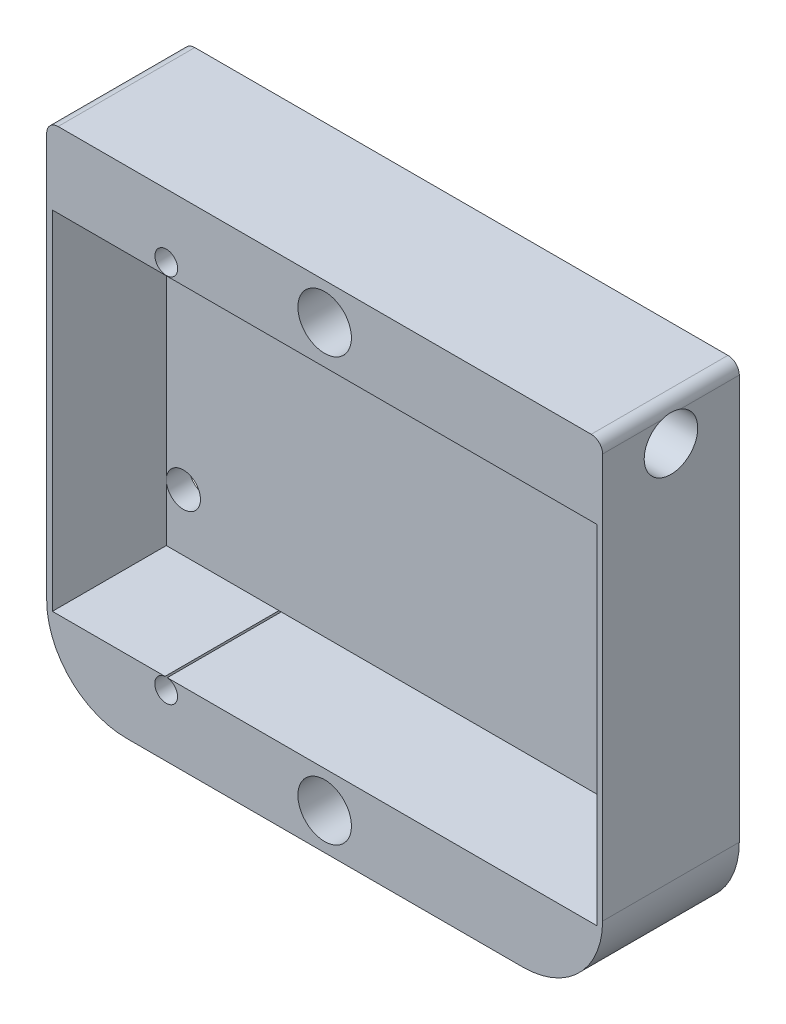
from build123d import *

# Parameters (mm, degrees)
SKIZZE4_W                       = 47.8
SKIZZE4_H                       = 37.511655438
AUFSATZ_LINEAR_AUSTRAGEN2_DEPTH = 2
SKIZZE5_W                       = 47.8
SKIZZE5_H                       = 3.6
SKIZZE5_H_2                     = 3.4
AUFSATZ_LINEAR_AUSTRAGEN3_DEPTH = 12
SKIZZE6_R                       = 1
SCHNITT_LINEAR_AUSTRAGEN1_DEPTH = 19
SKIZZE8_W                       = 47.8
SKIZZE8_H                       = 12
AUFSATZ_LINEAR_AUSTRAGEN4_DEPTH = 3
SKIZZE9_W                       = 47.8
SKIZZE9_H                       = 12
AUFSATZ_LINEAR_AUSTRAGEN5_DEPTH = 3
SKIZZE10_W                      = 12
SKIZZE10_H                      = 43.511655438
AUFSATZ_LINEAR_AUSTRAGEN6_DEPTH = 0.5
SKIZZE11_W                      = 12
SKIZZE11_H                      = 43.511655438
AUFSATZ_LINEAR_AUSTRAGEN7_DEPTH = 0.5
SKIZZE12_R                      = 1.5
SCHNITT_LINEAR_AUSTRAGEN2_DEPTH = 9
SCHNITT_LINEAR_START            = -9
SKIZZE13_R                      = 1.5
SCHNITT_LINEAR_AUSTRAGEN3_DEPTH = 9
SKIZZE14_R                      = 2.35
SCHNITT_LINEAR_AUSTRAGEN4_DEPTH = 4
SCHNITT_LINEAR_START_2          = -4
SKIZZE15_R                      = 2.35
SCHNITT_LINEAR_AUSTRAGEN5_DEPTH = 4
VERRUNDUNG3_R                   = 1
VERRUNDUNG4_R                   = 1
VERRUNDUNG5_R                   = 7
SKIZZE17_R                      = 2.35
SCHNITT_LINEAR_AUSTRAGEN6_DEPTH = 4
SKIZZE18_R                      = 1.5
SCHNITT_LINEAR_AUSTRAGEN7_DEPTH = 14
SKIZZE19_R                      = 1.5
SCHNITT_LINEAR_AUSTRAGEN8_DEPTH = 14


with BuildPart() as part:
    # Skizze4 → Aufsatz-Linear austragen2 (new body)
    with BuildSketch(Plane.XY):
        with Locations((11.372253432, 7.302337754)):
            Rectangle(SKIZZE4_W, SKIZZE4_H)
    extrude(amount=AUFSATZ_LINEAR_AUSTRAGEN2_DEPTH)

    # Skizze5 → Aufsatz-Linear austragen3 (add)
    with BuildSketch(Plane(origin=(0, 0, 0), x_dir=(-1, 0, 0), z_dir=(0, 0, -1))):
        with Locations((-11.372253432, 24.258165473)):
            Rectangle(SKIZZE5_W, SKIZZE5_H)
        with Locations((-11.372253432, -9.753489965)):
            Rectangle(SKIZZE5_W, SKIZZE5_H_2)
    extrude(amount=-AUFSATZ_LINEAR_AUSTRAGEN3_DEPTH)

    # Skizze6 → Schnitt-Linear austragen1 (cut)
    with BuildSketch(Plane(origin=(0, 0, 0), x_dir=(-1, 0, 0), z_dir=(0, 0, -1))):
        with Locations((2.527746568, 23.483879087)):
            Circle(SKIZZE6_R)
        with Locations((2.540359159, -9.04853229)):
            Circle(SKIZZE6_R)
    extrude(amount=-SCHNITT_LINEAR_AUSTRAGEN1_DEPTH, mode=Mode.SUBTRACT)

    # Skizze8 → Aufsatz-Linear austragen4 (add)
    with BuildSketch(Plane(origin=(0, 26.058165473, 0), x_dir=(1, 0, 0), z_dir=(0, 1, 0))):
        with Locations((11.372253432, -6)):
            Rectangle(SKIZZE8_W, SKIZZE8_H)
    extrude(amount=AUFSATZ_LINEAR_AUSTRAGEN4_DEPTH)

    # Skizze9 → Aufsatz-Linear austragen5 (add)
    with BuildSketch(Plane.XZ.offset(11.453489965)):
        with Locations((11.372253432, 6)):
            Rectangle(SKIZZE9_W, SKIZZE9_H)
    extrude(amount=AUFSATZ_LINEAR_AUSTRAGEN5_DEPTH)

    # Skizze10 → Aufsatz-Linear austragen6 (add)
    with BuildSketch(Plane.ZY.offset(12.527746568)):
        with Locations((6, 7.302337754)):
            Rectangle(SKIZZE10_W, SKIZZE10_H)
    extrude(amount=AUFSATZ_LINEAR_AUSTRAGEN6_DEPTH)

    # Skizze11 → Aufsatz-Linear austragen7 (add)
    with BuildSketch(Plane(origin=(35.272253432, 0, 0), x_dir=(0, 0, -1), z_dir=(1, 0, 0))):
        with Locations((-6, 7.302337754)):
            Rectangle(SKIZZE11_W, SKIZZE11_H)
    extrude(amount=AUFSATZ_LINEAR_AUSTRAGEN7_DEPTH)

    # Skizze12 → Schnitt-Linear austragen2 (cut)
    with BuildSketch(Plane.ZY.offset(13.027746568)):
        with Locations(Location((6, 25.858165473, 0), (0, 0, 270))):
            Circle(SKIZZE12_R)
    extrude(amount=-SCHNITT_LINEAR_AUSTRAGEN2_DEPTH, mode=Mode.SUBTRACT)

    # Skizze13 → Schnitt-Linear austragen3 (cut)
    with BuildSketch(Plane(origin=(35.772253432, 0, 0), x_dir=(0, 0, -1), z_dir=(1, 0, 0)).offset(SCHNITT_LINEAR_START)):
        with Locations(Location((-6, 25.858165473, 0), (0, 0, 270))):
            Circle(SKIZZE13_R)
    extrude(amount=SCHNITT_LINEAR_AUSTRAGEN3_DEPTH, mode=Mode.SUBTRACT)

    # Skizze14 → Schnitt-Linear austragen4 (cut)
    with BuildSketch(Plane.ZY.offset(13.027746568)):
        with Locations(Location((6, 25.858165473, 0), (0, 0, 270))):
            Circle(SKIZZE14_R)
    extrude(amount=-SCHNITT_LINEAR_AUSTRAGEN4_DEPTH, mode=Mode.SUBTRACT)

    # Skizze15 → Schnitt-Linear austragen5 (cut)
    with BuildSketch(Plane(origin=(35.772253432, 0, 0), x_dir=(0, 0, -1), z_dir=(1, 0, 0)).offset(SCHNITT_LINEAR_START_2)):
        with Locations(Location((-6, 25.858165473, 0), (0, 0, 270))):
            Circle(SKIZZE15_R)
    extrude(amount=SCHNITT_LINEAR_AUSTRAGEN5_DEPTH, mode=Mode.SUBTRACT)

    # Verrundung3
    # the kernel refuses this fillet: 1 mm, written as the material it takes off along each edge
    with BuildSketch(Plane(origin=(35.772253432, 29.058165473, 14.5), x_dir=(-1, 0, 0), z_dir=(0, 0, -1))) as verrundung3_piece_1:
        with BuildLine():
            CenterArc((VERRUNDUNG3_R, -VERRUNDUNG3_R), VERRUNDUNG3_R, 90, 90)
            Line((0, -VERRUNDUNG3_R), (0, 0))
            Line((0, 0), (VERRUNDUNG3_R, 0))
        make_face()
    extrude(amount=17, mode=Mode.SUBTRACT)

    # Verrundung4
    # the kernel refuses this fillet: 1 mm, written as the material it takes off along each edge
    with BuildSketch(Plane(origin=(-13.027746568, 29.058165473, 14.5), x_dir=(1, 0, 0), z_dir=(0, 0, -1))) as verrundung4_piece_1:
        with BuildLine():
            CenterArc((VERRUNDUNG4_R, VERRUNDUNG4_R), VERRUNDUNG4_R, 180, 90)
            Line((0, VERRUNDUNG4_R), (0, 0))
            Line((0, 0), (VERRUNDUNG4_R, 0))
        make_face()
    extrude(amount=17, mode=Mode.SUBTRACT)

    # Verrundung5
    verrundung5_edges = [part.edges().sort_by_distance(p)[0] for p in [
        (35.772253432, -14.453489965, 6),
        (-13.027746568, -14.453489965, 6),
    ]]
    fillet(verrundung5_edges, radius=VERRUNDUNG5_R)

    # Skizze17 → Schnitt-Linear austragen6 (cut)
    with BuildSketch(Plane.XY.offset(12)):
        with Locations((11.372253432, -11.253489965)):
            Circle(SKIZZE17_R)
        with Locations((11.372253432, 25.858165473)):
            Circle(SKIZZE17_R)
    extrude(amount=-SCHNITT_LINEAR_AUSTRAGEN6_DEPTH, mode=Mode.SUBTRACT)

    # Skizze18 → Schnitt-Linear austragen7 (cut)
    with BuildSketch(Plane.XY.offset(8)):
        with Locations((11.372253432, -11.253489965)):
            Circle(SKIZZE18_R)
        with Locations((11.372253432, 25.858165473)):
            Circle(SKIZZE18_R)
    extrude(amount=-SCHNITT_LINEAR_AUSTRAGEN7_DEPTH, mode=Mode.SUBTRACT)

    # Skizze19 → Schnitt-Linear austragen8 (cut)
    with BuildSketch(Plane.XY.offset(2)):
        with Locations((-11.027746568, -3.053489965)):
            Circle(SKIZZE19_R)
        with Locations((33.772253432, 17.458165473)):
            Circle(SKIZZE19_R)
    extrude(amount=-SCHNITT_LINEAR_AUSTRAGEN8_DEPTH, mode=Mode.SUBTRACT)


solid = part.part
